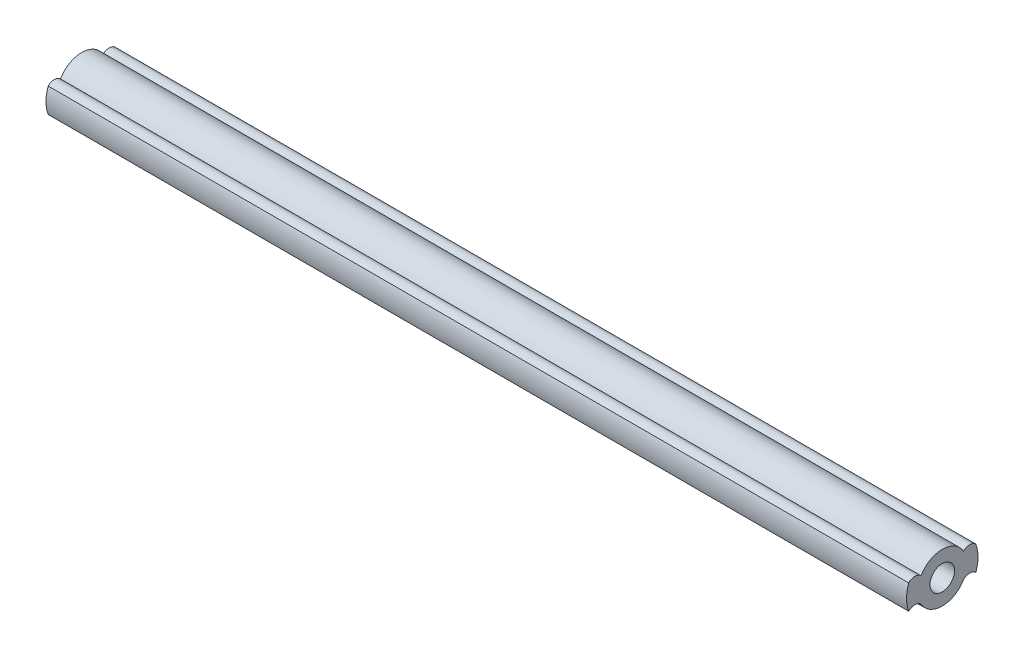
from build123d import *

# Parameters (mm, degrees)
SKETCH1_R           = 5
BOSS_EXTRUDE1_DEPTH = 350


with BuildPart() as part:
    # Sketch1 → Boss-Extrude1 (new body)
    with BuildSketch(Plane(origin=(0, 0, 0), x_dir=(0, 0, -1), z_dir=(1, 0, 0))):
        with BuildLine():
            ThreePointArc((8.653798961, -5.011163891), (11.157678989, -3.972789688), (13.662430885, -5.009059016))
            ThreePointArc((13.662430885, -5.009059016), (14.533959389, -0.004529508), (13.662430885, 5))
            ThreePointArc((13.662430885, 5), (11.160773363, 6.040295531), (8.656235338, 5.006954141))
            ThreePointArc((8.656235338, 5.006954141), (0, 10), (-8.656235338, 5.006954141))
            ThreePointArc((-8.656235338, 5.006954141), (-11.160773363, 6.040295531), (-13.662430885, 5))
            ThreePointArc((-13.662430885, 5), (-14.533959389, -0.004529508), (-13.662430885, -5.009059016))
            ThreePointArc((-13.662430885, -5.009059016), (-11.157678989, -3.972789688), (-8.653798961, -5.011163891))
            ThreePointArc((-8.653798961, -5.011163891), (0, -10), (8.653798961, -5.011163891))
        make_face()
        Circle(SKETCH1_R, mode=Mode.SUBTRACT)
    extrude(amount=BOSS_EXTRUDE1_DEPTH)


solid = part.part
